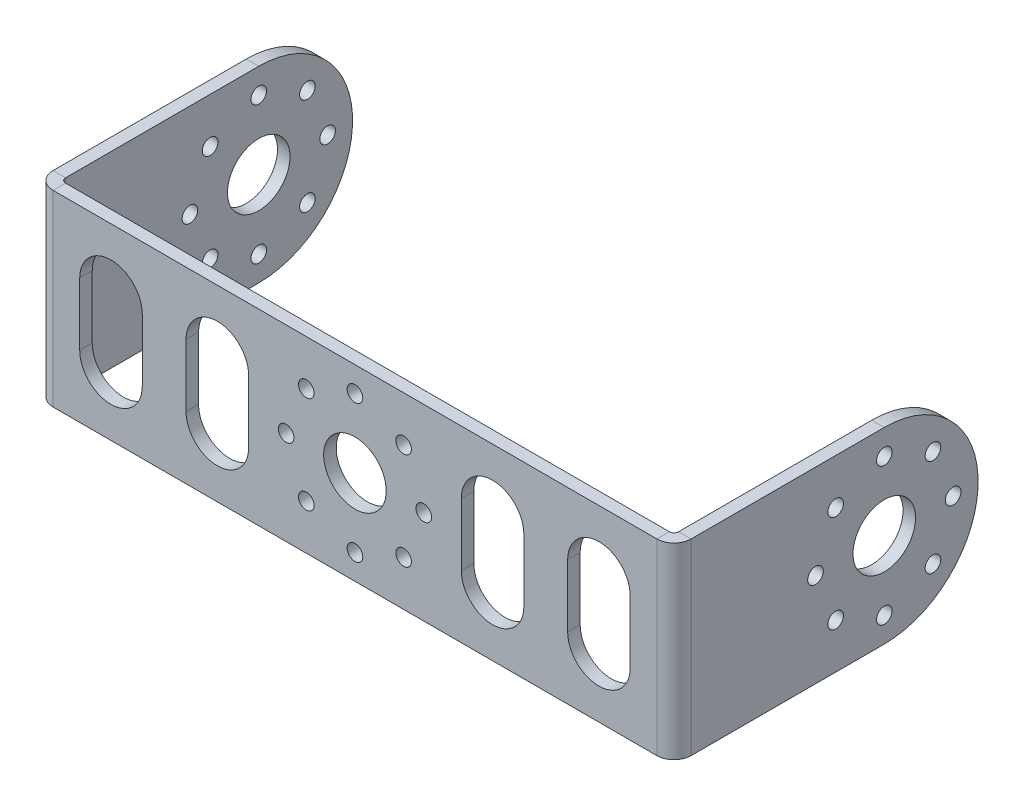
from build123d import *

# Parameters (mm, degrees)
ESBO_O1_W                        = 102
ESBO_O1_H                        = 30
ESBO_O1_R                        = 5
ESBO_O1_R_2                      = 1.25
RESSALTO_EXTRUS_O1_DEPTH         = 2
ESBO_O12_R                       = 1.25
RESSALTO_EXTRUS_O2_DEPTH         = 2
PLANIFICAR_DOBRAS1_START         = -48
PLANIFICAR_DOBRAS1_OUTLINE_W     = 2
PLANIFICAR_DOBRAS1_OUTLINE_H     = 30
PLANIFICAR_DOBRAS1_DEPTH         = 48
PLANIFICAR_DOBRAS1_2_OUTLINE_R   = 1.25
PLANIFICAR_DOBRAS1_2_OUTLINE_R_2 = 5
PLANIFICAR_DOBRAS1_2_DEPTH       = 2
PROCESSAR_DOBRAS1_START          = -159
PROCESSAR_DOBRAS1_OUTLINE_W      = 30
PROCESSAR_DOBRAS1_OUTLINE_H      = 2
PROCESSAR_DOBRAS1_DEPTH          = 49.7366
PROCESSAR_DOBRAS1_START_2        = -12.7366
PROCESSAR_DOBRAS1_2_OUTLINE_W    = 30
PROCESSAR_DOBRAS1_2_OUTLINE_H    = 2
PROCESSAR_DOBRAS1_2_DEPTH        = 49.7366
PROCESSAR_DOBRAS1_START_3        = -111.733838284
PROCESSAR_DOBRAS1_3_OUTLINE_R    = 1.25
PROCESSAR_DOBRAS1_3_OUTLINE_R_2  = 5
PROCESSAR_DOBRAS1_3_DEPTH        = 1.733838284
PROCESSAR_DOBRAS1_START_4        = -12
PROCESSAR_DOBRAS1_4_OUTLINE_R    = 1.25
PROCESSAR_DOBRAS1_4_OUTLINE_R_2  = 5
PROCESSAR_DOBRAS1_4_DEPTH        = 1.733838284
PROCESSAR_DOBRAS1_START_5        = -112
PROCESSAR_DOBRAS1_5_OUTLINE_R    = 1.25
PROCESSAR_DOBRAS1_5_OUTLINE_R_2  = 5
PROCESSAR_DOBRAS1_5_DEPTH        = 2.7366
PROCESSAR_DOBRAS1_6_OUTLINE_R    = 1.25
PROCESSAR_DOBRAS1_6_OUTLINE_R_2  = 5
PROCESSAR_DOBRAS1_6_DEPTH        = 2.7366
PROCESSAR_DOBRAS1_7_DEPTH        = 30
PROCESSAR_DOBRAS1_8_DEPTH        = 30
CORTE_EXTRUS_O1_DEPTH            = 10


with BuildPart() as part:
    # Esboço1 → Ressalto-extrusão1 (new body)
    with BuildSketch(Plane.XY):
        with Locations((-61, 15)):
            Rectangle(ESBO_O1_W, ESBO_O1_H)
        with Locations((-61, 15)):
            Circle(ESBO_O1_R, mode=Mode.SUBTRACT)
        with Locations((-72, 15)):
            Circle(ESBO_O1_R_2, mode=Mode.SUBTRACT)
        with Locations((-68.778174593, 22.778174593)):
            Circle(ESBO_O1_R_2, mode=Mode.SUBTRACT)
        with Locations((-61, 26)):
            Circle(ESBO_O1_R_2, mode=Mode.SUBTRACT)
        with Locations((-53.221825407, 22.778174593)):
            Circle(ESBO_O1_R_2, mode=Mode.SUBTRACT)
        with Locations((-50, 15)):
            Circle(ESBO_O1_R_2, mode=Mode.SUBTRACT)
        with Locations((-53.221825407, 7.221825407)):
            Circle(ESBO_O1_R_2, mode=Mode.SUBTRACT)
        with Locations((-61, 4)):
            Circle(ESBO_O1_R_2, mode=Mode.SUBTRACT)
        with Locations((-68.778174593, 7.221825407)):
            Circle(ESBO_O1_R_2, mode=Mode.SUBTRACT)
    extrude(amount=RESSALTO_EXTRUS_O1_DEPTH)

    # Esboço12 → Ressalto-extrusão2 (add)
    with BuildSketch(Plane(origin=(-10, 0, 0), x_dir=(0, 0, -1), z_dir=(1, 0, 0))):
        with BuildLine():
            Line((0, 30), (0, 0))
            Line((0, 0), (8, 0))
            Line((8, 0), (31.622387861, 0))
            ThreePointArc((31.622387861, 0), (46.621193931, 15.001193931), (31.62, 30))
            Line((31.62, 30), (18, 30))
            Line((18, 30), (0, 30))
        make_face()
        with Locations(Location((23.843019338, 7.221825407, 0), (0, 0, 90))):
            Circle(ESBO_O12_R, mode=Mode.SUBTRACT)
        with Locations(Location((20.621193931, 15, 0), (0, 0, 90))):
            Circle(ESBO_O12_R, mode=Mode.SUBTRACT)
        with Locations(Location((31.621193931, 4, 0), (0, 0, 90))):
            Circle(ESBO_O12_R, mode=Mode.SUBTRACT)
        with Locations(Location((39.399368524, 7.221825407, 0), (0, 0, 90))):
            Circle(ESBO_O12_R, mode=Mode.SUBTRACT)
        with Locations(Location((23.843019338, 22.778174593, 0), (0, 0, 90))):
            Circle(ESBO_O12_R, mode=Mode.SUBTRACT)
        with BuildLine():
            ThreePointArc((28.085660025, 11.464466094), (28.085660025, 18.535533906), (35.156727837, 18.535533906))
            ThreePointArc((35.156727837, 18.535533906), (35.156727837, 11.464466094), (28.085660025, 11.464466094))
        make_face(mode=Mode.SUBTRACT)
        with Locations(Location((42.621193931, 15, 0), (0, 0, 90))):
            Circle(ESBO_O12_R, mode=Mode.SUBTRACT)
        with Locations(Location((31.621193931, 26, 0), (0, 0, 90))):
            Circle(ESBO_O12_R, mode=Mode.SUBTRACT)
        with Locations(Location((39.399368524, 22.778174593, 0), (0, 0, 90))):
            Circle(ESBO_O12_R, mode=Mode.SUBTRACT)
    ressalto_extrus_o2 = extrude(amount=-RESSALTO_EXTRUS_O2_DEPTH)

    # Espelhar1: Ressalto-extrusão2 across plane
    add(ressalto_extrus_o2.mirror(Plane.ZY.offset(61)))

    # Planificar-Dobras1: read off the stored shape, not the designer's step
    # Planificar-Dobras1 outline → Planificar-Dobras1 (cut)
    with BuildSketch(Plane.XY.offset(PLANIFICAR_DOBRAS1_START)):
        with Locations((-11, 15)):
            Rectangle(PLANIFICAR_DOBRAS1_OUTLINE_W, PLANIFICAR_DOBRAS1_OUTLINE_H)
        with Locations((-111, 15)):
            Rectangle(PLANIFICAR_DOBRAS1_OUTLINE_W, PLANIFICAR_DOBRAS1_OUTLINE_H)
    extrude(amount=PLANIFICAR_DOBRAS1_DEPTH, mode=Mode.SUBTRACT)

    # Planificar-Dobras1 2 outline → Planificar-Dobras1 2 (add)
    # profile 1 of 2: a face of its own
    with BuildSketch(Plane.XY):
        with BuildLine():
            Line((-10, 30), (-10, 0))
            Line((-10, 0), (20.877032763, 0))
            ThreePointArc((20.877032763, 0), (35.875838867, 15.000596966), (20.875838832, 30.000000048))
            Line((20.875838832, 30.000000048), (-10, 30))
        make_face()
        with Locations((20.875838832, 4)):
            Circle(PLANIFICAR_DOBRAS1_2_OUTLINE_R, mode=Mode.SUBTRACT)
        with Locations((13.097664239, 7.221825407)):
            Circle(PLANIFICAR_DOBRAS1_2_OUTLINE_R, mode=Mode.SUBTRACT)
        with Locations((28.654013425, 7.221825407)):
            Circle(PLANIFICAR_DOBRAS1_2_OUTLINE_R, mode=Mode.SUBTRACT)
        with Locations((9.875838832, 15)):
            Circle(PLANIFICAR_DOBRAS1_2_OUTLINE_R, mode=Mode.SUBTRACT)
        with Locations((20.875838832, 15)):
            Circle(PLANIFICAR_DOBRAS1_2_OUTLINE_R_2, mode=Mode.SUBTRACT)
        with Locations((31.875838832, 15)):
            Circle(PLANIFICAR_DOBRAS1_2_OUTLINE_R, mode=Mode.SUBTRACT)
        with Locations((13.097664239, 22.778174593)):
            Circle(PLANIFICAR_DOBRAS1_2_OUTLINE_R, mode=Mode.SUBTRACT)
        with Locations((28.654013425, 22.778174593)):
            Circle(PLANIFICAR_DOBRAS1_2_OUTLINE_R, mode=Mode.SUBTRACT)
        with Locations((20.875838832, 26)):
            Circle(PLANIFICAR_DOBRAS1_2_OUTLINE_R, mode=Mode.SUBTRACT)
    # profile 2 of 2: a face of its own
    with BuildSketch(Plane.XY):
        with BuildLine():
            Line((-142.877032763, 0), (-112, 0))
            Line((-112, 0), (-112, 30))
            Line((-112, 30), (-142.875838832, 30.000000048))
            ThreePointArc((-142.875838832, 30.000000048), (-157.875838867, 15.000596966), (-142.877032763, 0))
        make_face()
        with Locations((-142.875838832, 4)):
            Circle(PLANIFICAR_DOBRAS1_2_OUTLINE_R, mode=Mode.SUBTRACT)
        with Locations((-150.654013425, 7.221825407)):
            Circle(PLANIFICAR_DOBRAS1_2_OUTLINE_R, mode=Mode.SUBTRACT)
        with Locations((-135.097664239, 7.221825407)):
            Circle(PLANIFICAR_DOBRAS1_2_OUTLINE_R, mode=Mode.SUBTRACT)
        with Locations((-153.875838832, 15)):
            Circle(PLANIFICAR_DOBRAS1_2_OUTLINE_R, mode=Mode.SUBTRACT)
        with Locations((-142.875838832, 15)):
            Circle(PLANIFICAR_DOBRAS1_2_OUTLINE_R_2, mode=Mode.SUBTRACT)
        with Locations((-131.875838832, 15)):
            Circle(PLANIFICAR_DOBRAS1_2_OUTLINE_R, mode=Mode.SUBTRACT)
        with Locations((-150.654013425, 22.778174593)):
            Circle(PLANIFICAR_DOBRAS1_2_OUTLINE_R, mode=Mode.SUBTRACT)
        with Locations((-135.097664239, 22.778174593)):
            Circle(PLANIFICAR_DOBRAS1_2_OUTLINE_R, mode=Mode.SUBTRACT)
        with Locations((-142.875838832, 26)):
            Circle(PLANIFICAR_DOBRAS1_2_OUTLINE_R, mode=Mode.SUBTRACT)
    extrude(amount=PLANIFICAR_DOBRAS1_2_DEPTH)

    # Processar-Dobras1: read off the stored shape, not the designer's step
    # Processar-Dobras1 outline → Processar-Dobras1 (cut)
    with BuildSketch(Plane.YZ.offset(PROCESSAR_DOBRAS1_START)):
        with Locations((15, 1)):
            Rectangle(PROCESSAR_DOBRAS1_OUTLINE_W, PROCESSAR_DOBRAS1_OUTLINE_H)
    extrude(amount=PROCESSAR_DOBRAS1_DEPTH, mode=Mode.SUBTRACT)

    # Processar-Dobras1 2 outline → Processar-Dobras1 2 (cut)
    with BuildSketch(Plane.YZ.offset(PROCESSAR_DOBRAS1_START_2)):
        with Locations((15, 1)):
            Rectangle(PROCESSAR_DOBRAS1_2_OUTLINE_W, PROCESSAR_DOBRAS1_2_OUTLINE_H)
    extrude(amount=PROCESSAR_DOBRAS1_2_DEPTH, mode=Mode.SUBTRACT)



with BuildPart() as body_2:
    # Processar-Dobras1 3 outline → Processar-Dobras1 3 (new body)
    with BuildSketch(Plane.YZ.offset(PROCESSAR_DOBRAS1_START_3)):
        with BuildLine():
            ThreePointArc((0, -31.622387861), (15.000596965, -46.621193966), (30.000000048, -31.621193931))
            Line((30.000000048, -31.621193931), (30, 0))
            Line((30, 0), (0, 0))
            Line((0, 0), (0, -31.622387861))
        make_face()
        with Locations((7.221825407, -39.399368524)):
            Circle(PROCESSAR_DOBRAS1_3_OUTLINE_R, mode=Mode.SUBTRACT)
        with Locations((15, -42.621193931)):
            Circle(PROCESSAR_DOBRAS1_3_OUTLINE_R, mode=Mode.SUBTRACT)
        with Locations((4, -31.621193931)):
            Circle(PROCESSAR_DOBRAS1_3_OUTLINE_R, mode=Mode.SUBTRACT)
        with Locations((7.221825407, -23.843019338)):
            Circle(PROCESSAR_DOBRAS1_3_OUTLINE_R, mode=Mode.SUBTRACT)
        with Locations((15, -31.621193931)):
            Circle(PROCESSAR_DOBRAS1_3_OUTLINE_R_2, mode=Mode.SUBTRACT)
        with Locations((22.778174593, -39.399368524)):
            Circle(PROCESSAR_DOBRAS1_3_OUTLINE_R, mode=Mode.SUBTRACT)
        with Locations((26, -31.621193931)):
            Circle(PROCESSAR_DOBRAS1_3_OUTLINE_R, mode=Mode.SUBTRACT)
        with Locations((22.778174593, -23.843019338)):
            Circle(PROCESSAR_DOBRAS1_3_OUTLINE_R, mode=Mode.SUBTRACT)
        with Locations((15, -20.621193931)):
            Circle(PROCESSAR_DOBRAS1_3_OUTLINE_R, mode=Mode.SUBTRACT)
    extrude(amount=PROCESSAR_DOBRAS1_3_DEPTH)


with BuildPart() as body_3:
    # Processar-Dobras1 4 outline → Processar-Dobras1 4 (new body)
    with BuildSketch(Plane.YZ.offset(PROCESSAR_DOBRAS1_START_4)):
        with BuildLine():
            ThreePointArc((0, -31.622387861), (15.000596965, -46.621193966), (30.000000048, -31.621193931))
            Line((30.000000048, -31.621193931), (30, 0))
            Line((30, 0), (0, 0))
            Line((0, 0), (0, -31.622387861))
        make_face()
        with Locations((7.221825407, -39.399368524)):
            Circle(PROCESSAR_DOBRAS1_4_OUTLINE_R, mode=Mode.SUBTRACT)
        with Locations((15, -42.621193931)):
            Circle(PROCESSAR_DOBRAS1_4_OUTLINE_R, mode=Mode.SUBTRACT)
        with Locations((4, -31.621193931)):
            Circle(PROCESSAR_DOBRAS1_4_OUTLINE_R, mode=Mode.SUBTRACT)
        with Locations((7.221825407, -23.843019338)):
            Circle(PROCESSAR_DOBRAS1_4_OUTLINE_R, mode=Mode.SUBTRACT)
        with Locations((15, -31.621193931)):
            Circle(PROCESSAR_DOBRAS1_4_OUTLINE_R_2, mode=Mode.SUBTRACT)
        with Locations((22.778174593, -39.399368524)):
            Circle(PROCESSAR_DOBRAS1_4_OUTLINE_R, mode=Mode.SUBTRACT)
        with Locations((26, -31.621193931)):
            Circle(PROCESSAR_DOBRAS1_4_OUTLINE_R, mode=Mode.SUBTRACT)
        with Locations((22.778174593, -23.843019338)):
            Circle(PROCESSAR_DOBRAS1_4_OUTLINE_R, mode=Mode.SUBTRACT)
        with Locations((15, -20.621193931)):
            Circle(PROCESSAR_DOBRAS1_4_OUTLINE_R, mode=Mode.SUBTRACT)
    extrude(amount=PROCESSAR_DOBRAS1_4_DEPTH)


with BuildPart() as part_1:
    add(part.part)

    add(body_2.part)  # Processar-Dobras1 5 merges body 2
    # Processar-Dobras1 5 outline → Processar-Dobras1 5 (add)
    with BuildSketch(Plane.YZ.offset(PROCESSAR_DOBRAS1_START_5)):
        with BuildLine():
            ThreePointArc((0, -31.622387861), (15.000596965, -46.621193966), (30.000000048, -31.621193931))
            Line((30.000000048, -31.621193931), (30, 0))
            Line((30, 0), (0, 0))
            Line((0, 0), (0, -31.622387861))
        make_face()
        with Locations((7.221825407, -39.399368524)):
            Circle(PROCESSAR_DOBRAS1_5_OUTLINE_R, mode=Mode.SUBTRACT)
        with Locations((15, -42.621193931)):
            Circle(PROCESSAR_DOBRAS1_5_OUTLINE_R, mode=Mode.SUBTRACT)
        with Locations((4, -31.621193931)):
            Circle(PROCESSAR_DOBRAS1_5_OUTLINE_R, mode=Mode.SUBTRACT)
        with Locations((7.221825407, -23.843019338)):
            Circle(PROCESSAR_DOBRAS1_5_OUTLINE_R, mode=Mode.SUBTRACT)
        with Locations((15, -31.621193931)):
            Circle(PROCESSAR_DOBRAS1_5_OUTLINE_R_2, mode=Mode.SUBTRACT)
        with Locations((22.778174593, -39.399368524)):
            Circle(PROCESSAR_DOBRAS1_5_OUTLINE_R, mode=Mode.SUBTRACT)
        with Locations((26, -31.621193931)):
            Circle(PROCESSAR_DOBRAS1_5_OUTLINE_R, mode=Mode.SUBTRACT)
        with Locations((22.778174593, -23.843019338)):
            Circle(PROCESSAR_DOBRAS1_5_OUTLINE_R, mode=Mode.SUBTRACT)
        with Locations((15, -20.621193931)):
            Circle(PROCESSAR_DOBRAS1_5_OUTLINE_R, mode=Mode.SUBTRACT)
    extrude(amount=PROCESSAR_DOBRAS1_5_DEPTH)


    add(body_3.part)  # Processar-Dobras1 6 merges body 3
    # Processar-Dobras1 6 outline → Processar-Dobras1 6 (add)
    with BuildSketch(Plane.YZ.offset(PROCESSAR_DOBRAS1_START_2)):
        with BuildLine():
            ThreePointArc((0, -31.622387861), (15.000596965, -46.621193966), (30.000000048, -31.621193931))
            Line((30.000000048, -31.621193931), (30, 0))
            Line((30, 0), (0, 0))
            Line((0, 0), (0, -31.622387861))
        make_face()
        with Locations((7.221825407, -39.399368524)):
            Circle(PROCESSAR_DOBRAS1_6_OUTLINE_R, mode=Mode.SUBTRACT)
        with Locations((15, -42.621193931)):
            Circle(PROCESSAR_DOBRAS1_6_OUTLINE_R, mode=Mode.SUBTRACT)
        with Locations((4, -31.621193931)):
            Circle(PROCESSAR_DOBRAS1_6_OUTLINE_R, mode=Mode.SUBTRACT)
        with Locations((7.221825407, -23.843019338)):
            Circle(PROCESSAR_DOBRAS1_6_OUTLINE_R, mode=Mode.SUBTRACT)
        with Locations((15, -31.621193931)):
            Circle(PROCESSAR_DOBRAS1_6_OUTLINE_R_2, mode=Mode.SUBTRACT)
        with Locations((22.778174593, -39.399368524)):
            Circle(PROCESSAR_DOBRAS1_6_OUTLINE_R, mode=Mode.SUBTRACT)
        with Locations((26, -31.621193931)):
            Circle(PROCESSAR_DOBRAS1_6_OUTLINE_R, mode=Mode.SUBTRACT)
        with Locations((22.778174593, -23.843019338)):
            Circle(PROCESSAR_DOBRAS1_6_OUTLINE_R, mode=Mode.SUBTRACT)
        with Locations((15, -20.621193931)):
            Circle(PROCESSAR_DOBRAS1_6_OUTLINE_R, mode=Mode.SUBTRACT)
    extrude(amount=PROCESSAR_DOBRAS1_6_DEPTH)

    # Processar-Dobras1 7 outline → Processar-Dobras1 7 (cut)
    with BuildSketch(Plane(origin=(0, 0, 0), x_dir=(1, 0, 0), z_dir=(0, 1, 0))):
        with BuildLine():
            Line((-110, 48), (-110, 0.7366))
            ThreePointArc((-110, 0.7366), (-109.784254855, 0.215745145), (-109.2634, 0))
            Line((-109.2634, 0), (-109.2634, 48))
            Line((-109.2634, 48), (-110, 48))
        make_face()
        with BuildLine():
            Line((-112, 0.7366), (-112.000000023, 48))
            Line((-112.000000023, 48), (-113, 48))
            Line((-113, 48), (-113, 0))
            Line((-113, 0), (-111.899002398, 0))
            ThreePointArc((-111.899002398, 0), (-111.974633029, 0.364854094), (-112, 0.7366))
        make_face()
        with BuildLine():
            Line((-12, 48), (-12.7366, 48))
            Line((-12.7366, 48), (-12.7366, 0))
            ThreePointArc((-12.7366, 0), (-12.215745145, 0.215745145), (-12, 0.7366))
            Line((-12, 0.7366), (-12, 48))
        make_face()
        with BuildLine():
            Line((-9, 48), (-9.999999977, 48))
            Line((-9.999999977, 48), (-10, 0.7366))
            ThreePointArc((-10, 0.7366), (-10.025366971, 0.364854094), (-10.100997602, 0))
            Line((-10.100997602, 0), (-9, 0))
            Line((-9, 0), (-9, 48))
        make_face()
    extrude(amount=PROCESSAR_DOBRAS1_7_DEPTH, mode=Mode.SUBTRACT)

    # Processar-Dobras1 8 outline → Processar-Dobras1 8 (add)
    with BuildSketch(Plane(origin=(0, 0, 0), x_dir=(1, 0, 0), z_dir=(0, 1, 0))):
        with BuildLine():
            Line((-109.2634, -2), (-109.2634, 0))
            Line((-109.2634, 0), (-111.899002398, 0))
            ThreePointArc((-111.899002398, 0), (-110.917667209, -1.443395312), (-109.2634, -2))
        make_face()
        with BuildLine():
            Line((-10.100997602, 0), (-12.7366, 0))
            Line((-12.7366, 0), (-12.7366, -2))
            ThreePointArc((-12.7366, -2), (-11.082332791, -1.443395312), (-10.100997602, 0))
        make_face()
    extrude(amount=PROCESSAR_DOBRAS1_8_DEPTH)

    # Esboço17 → Corte-extrusão1 (cut)
    with BuildSketch(Plane.XY.offset(2)):
        with BuildLine():
            Line((-27, 10), (-27, 20))
            ThreePointArc((-27, 20), (-22, 25), (-17, 20))
            Line((-17, 20), (-17, 10))
            ThreePointArc((-17, 10), (-22, 5), (-27, 10))
        make_face()
        with BuildLine():
            Line((-44, 10), (-44, 20))
            ThreePointArc((-44, 20), (-39, 25), (-34, 20))
            Line((-34, 20), (-34, 10))
            ThreePointArc((-34, 10), (-39, 5), (-44, 10))
        make_face()
    corte_extrus_o1 = extrude(amount=-CORTE_EXTRUS_O1_DEPTH, mode=Mode.SUBTRACT)

    # Espelhar2: Corte-extrusão1 across plane
    add(corte_extrus_o1.mirror(Plane.ZY.offset(61)), mode=Mode.SUBTRACT)


solid = part_1.part
